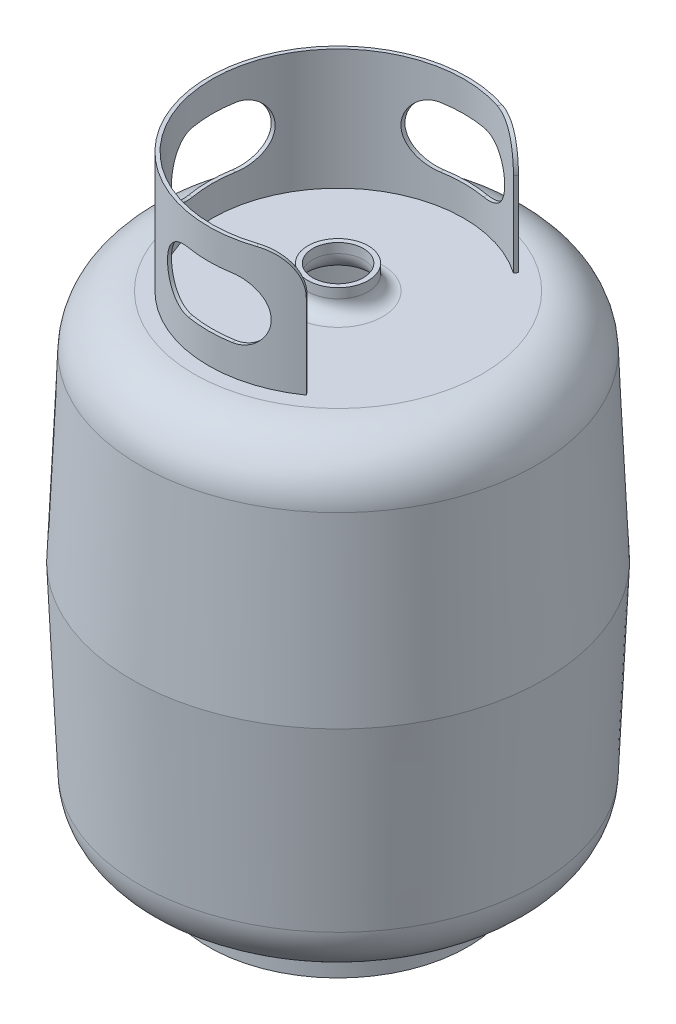
from build123d import *

# Parameters (mm, degrees)
CUT_EXTRUDE1_START      = -34
SKETCH2_R               = 21
CUT_EXTRUDE1_DEPTH      = 34
BOSS_EXTRUDE1_DEPTH     = 100
FILLET3_R               = 30
FILLET4_R               = 30
CUT_EXTRUDE2_DEPTH      = 545.160288764
CUT_EXTRUDE3_DEPTH      = 545.160288764
CUT_EXTRUDE3_DEPTH_BACK = 545.160288764
SKETCH7_R               = 107.421871599
SKETCH7_R_2             = 104.421871599
BOSS_EXTRUDE2_DEPTH     = 30


with BuildPart() as part:
    # Sketch1 → Revolve1 (revolve)
    with BuildSketch(Plane(origin=(0, 0, 0), x_dir=(0, 0, -1), z_dir=(1, 0, 0))):
        with BuildLine():
            Line((0, 0), (119.421871599, 0))
            ThreePointArc((119.421871599, 0), (150.539959109, 12.493621707), (164.37904157, 43.037127569))
            Line((164.37904157, 43.037127569), (170.959307689, 193.75))
            Line((170.959307689, 193.75), (164.37904157, 344.462872431))
            ThreePointArc((164.37904157, 344.462872431), (150.539959109, 375.006378293), (119.421871599, 387.5))
            Line((119.421871599, 387.5), (37, 387.5))
            ThreePointArc((37, 387.5), (28.514718626, 391.014718626), (25, 399.5))
            Line((25, 399.5), (25, 407.5))
            Line((25, 407.5), (0, 407.5))
            Line((0, 407.5), (0, 403.5))
            Line((0, 403.5), (21, 403.5))
            Line((21, 403.5), (21, 399.5))
            ThreePointArc((21, 399.5), (25.686291501, 388.186291501), (37, 383.5))
            Line((37, 383.5), (119.421871599, 383.5))
            ThreePointArc((119.421871599, 383.5), (147.773906886, 372.116922444), (160.382848683, 344.288394882))
            Line((160.382848683, 344.288394882), (166.955496948, 193.75))
            Line((166.955496948, 193.75), (160.382848683, 43.211605118))
            ThreePointArc((160.382848683, 43.211605118), (147.773906886, 15.383077556), (119.421871599, 4))
            Line((119.421871599, 4), (0, 4))
            Line((0, 4), (0, 0))
        make_face()
    revolve(axis=Axis((0, 0, 0), (0, 1, 0)))

    # Sketch2 → Cut-Extrude1 (cut)
    with BuildSketch(Plane(origin=(0, 407.5, 0), x_dir=(1, 0, 0), z_dir=(0, 1, 0)).offset(CUT_EXTRUDE1_START)):
        with Locations(Location((0, 0, 0), (0, 0, 90))):
            Circle(SKETCH2_R)
    extrude(amount=CUT_EXTRUDE1_DEPTH, mode=Mode.SUBTRACT)

    # Sketch7 → Boss-Extrude2 (add)
    with BuildSketch(Plane.XZ):
        with Locations(Location((0, 0, 0), (0, 0, 270))):
            Circle(SKETCH7_R)
        with Locations(Location((0, 0, 0), (0, 0, 270))):
            Circle(SKETCH7_R_2, mode=Mode.SUBTRACT)
    extrude(amount=BOSS_EXTRUDE2_DEPTH)


with BuildPart() as body_2:
    # Sketch3 → Boss-Extrude1 (new body)
    with BuildSketch(Plane(origin=(0, 387.5, 0), x_dir=(1, 0, 0), z_dir=(0, 1, 0))):
        with BuildLine():
            Line((59.893924989, -85.537389588), (61.614654298, -87.994845721))
            ThreePointArc((61.614654298, -87.994845721), (-107.421871599, 0), (61.614654298, 87.994845721))
            Line((61.614654298, 87.994845721), (59.893924989, 85.537389588))
            ThreePointArc((59.893924989, 85.537389588), (-104.421871599, 0), (59.893924989, -85.537389588))
        make_face()
    extrude(amount=BOSS_EXTRUDE1_DEPTH)

    # Fillet3
    # the kernel refuses this fillet: 30 mm, written as the material it takes off along each edge
    with BuildSketch(Plane(origin=(104.632887024, 487.5, -149.431249043), x_dir=(0, -1, 0), z_dir=(-0.5735764363510444, 0, 0.8191520442889931))) as fillet3_piece_1:
        with BuildLine():
            CenterArc((FILLET3_R, -FILLET3_R), FILLET3_R, 90, 90)
            Line((0, -FILLET3_R), (0, 0))
            Line((0, 0), (FILLET3_R, 0))
        make_face()
    extrude(amount=153, mode=Mode.SUBTRACT)

    # Fillet4
    # the kernel refuses this fillet: 30 mm, written as the material it takes off along each edge
    with BuildSketch(Plane(origin=(16.875692262, 487.5, 24.100986267), x_dir=(0, -1, 0), z_dir=(0.5735764363510459, 0, 0.8191520442889919))) as fillet4_piece_1_section:
        with BuildLine():
            CenterArc((FILLET4_R, -FILLET4_R), FILLET4_R, 90, 90)
            Line((0, -FILLET4_R), (-FILLET4_R * 0.02, -FILLET4_R))
            Line((-FILLET4_R * 0.02, -FILLET4_R), (-FILLET4_R * 0.02, FILLET4_R * 0.02))
            Line((-FILLET4_R * 0.02, FILLET4_R * 0.02), (FILLET4_R, FILLET4_R * 0.02))
            Line((FILLET4_R, FILLET4_R * 0.02), (FILLET4_R, 0))
        make_face()
    fillet4_piece_1 = extrude(amount=153, mode=Mode.PRIVATE)
    fillet4_piece_1 = fillet4_piece_1 - Plane(origin=(0, 480.728118084, 0), x_dir=(0.5735764363510439, 0, -0.8191520442889935), z_dir=(0, -1, 0)) * Cylinder(104.421871599, 427, mode=Mode.PRIVATE)
    fillet4_piece_1 = fillet4_piece_1 & Plane(origin=(0, 480.728118084, 0), x_dir=(0.5735764363510444, 0, 0.819152044288993), z_dir=(0, -1, 0)) * Cylinder(107.421871599, 427, mode=Mode.PRIVATE)
    add(fillet4_piece_1, mode=Mode.SUBTRACT)

    # Sketch5 → Cut-Extrude2 (cut, through all)
    with BuildSketch(Plane(origin=(0, 0, 0), x_dir=(0, 0, -1), z_dir=(1, 0, 0))):
        with BuildLine():
            Line((-18, 462.5), (18, 462.5))
            ThreePointArc((18, 462.5), (43, 437.5), (18, 412.5))
            Line((18, 412.5), (-18, 412.5))
            ThreePointArc((-18, 412.5), (-43, 437.5), (-18, 462.5))
        make_face()
    extrude(amount=-CUT_EXTRUDE2_DEPTH, mode=Mode.SUBTRACT)

    # Sketch6 → Cut-Extrude3 (cut, two sides: drawn at the far end of the back side and taken through both)
    with BuildSketch(Plane.XY.offset(-CUT_EXTRUDE3_DEPTH_BACK)):
        with BuildLine():
            Line((-18, 462.5), (18, 462.5))
            ThreePointArc((18, 462.5), (43, 437.5), (18, 412.5))
            Line((18, 412.5), (-18, 412.5))
            ThreePointArc((-18, 412.5), (-43, 437.5), (-18, 462.5))
        make_face()
    extrude(amount=CUT_EXTRUDE3_DEPTH + CUT_EXTRUDE3_DEPTH_BACK, mode=Mode.SUBTRACT)


solid = Compound([part.part, body_2.part])
